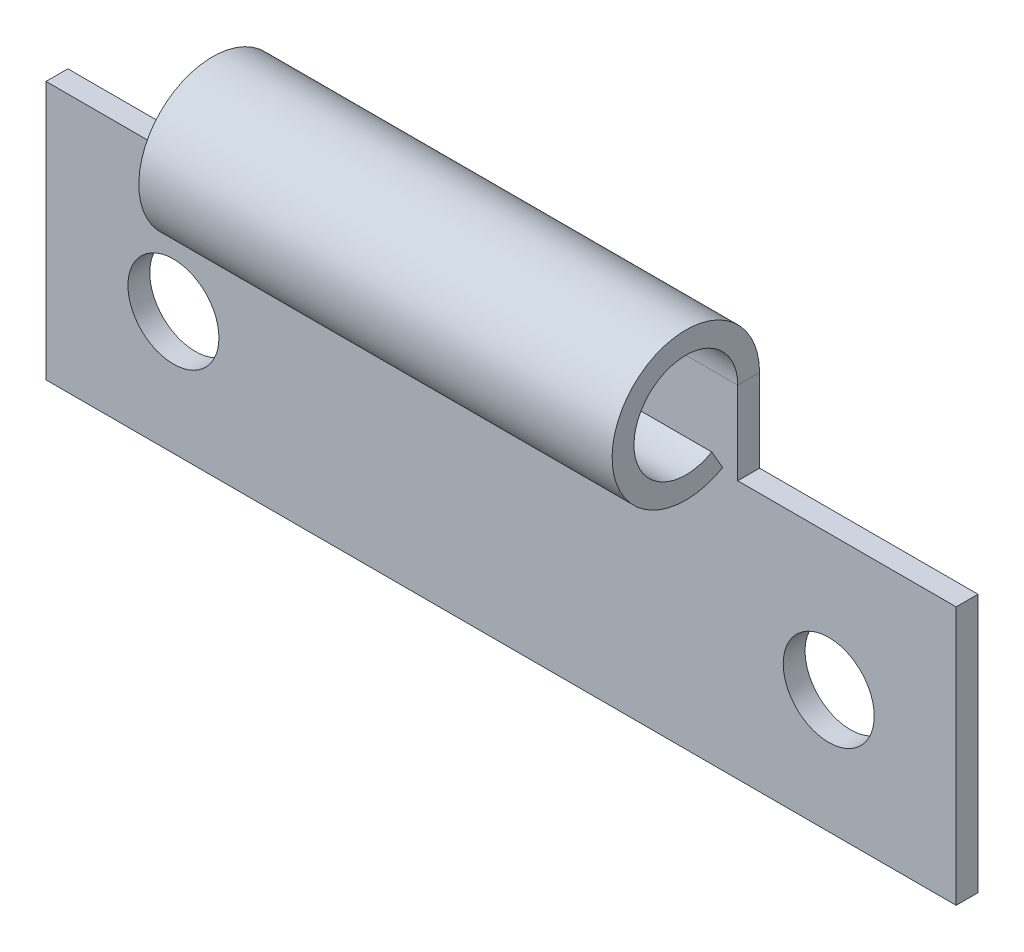
from build123d import *

# Parameters (mm, degrees)
SKETCH_1_W               = 50
SKETCH_1_H               = 18.75
SM_BASE_FLANGE_1_DEPTH   = 1.2
OTHER_START              = -25
OTHER_1_DEPTH            = 50
SKETCH_12_R              = 2.5
CUT_EXTRUDE_3_DEPTH      = 10
CUT_EXTRUDE_1_DEPTH      = 30.203435157
CUT_EXTRUDE_1_DEPTH_BACK = 30.203435157
SKETCH_10_W              = 12
SKETCH_10_H              = 8.6


# Read off the part's stored shape, not the designer's step: 褶边1
# Sheet-metal steps are written as plain solids
with BuildPart() as part:
    # Sketch 1 → 基体-法兰1 (new body)
    with BuildSketch(Plane.XY):
        Rectangle(SKETCH_1_W, SKETCH_1_H)
    extrude(amount=-SM_BASE_FLANGE_1_DEPTH)

    # Other 1 outline → Other 1 (add)
    with BuildSketch(Plane.YZ.offset(OTHER_START)):
        with BuildLine():
            Line((5.867597115, 0.825), (6.906827599, 1.425))
            ThreePointArc((6.906827599, 1.425), (10.8, 5.318172401), (9.375, 0))
            Line((9.375, 0), (9.375, -1.2))
            ThreePointArc((9.375, -1.2), (11.4, 6.357402885), (5.867597115, 0.825))
        make_face()
    extrude(amount=OTHER_1_DEPTH)

    # 草图12 → 切除-拉伸3 (cut)
    with BuildSketch(Plane.XY):
        with Locations((-18, -2.625)):
            Circle(SKETCH_12_R)
        with Locations((18, -2.625)):
            Circle(SKETCH_12_R)
    extrude(amount=-CUT_EXTRUDE_3_DEPTH, mode=Mode.SUBTRACT)

    # 草图10 → 切除-拉伸1 (cut, two sides: drawn at the far end of the back side and taken through both)
    with BuildSketch(Plane.XY.offset(-CUT_EXTRUDE_1_DEPTH_BACK)):
        with Locations((-19, 9.125)):
            Rectangle(SKETCH_10_W, SKETCH_10_H)
        with Locations((19, 9.125)):
            Rectangle(SKETCH_10_W, SKETCH_10_H)
    extrude(amount=CUT_EXTRUDE_1_DEPTH + CUT_EXTRUDE_1_DEPTH_BACK, mode=Mode.SUBTRACT)


solid = part.part
